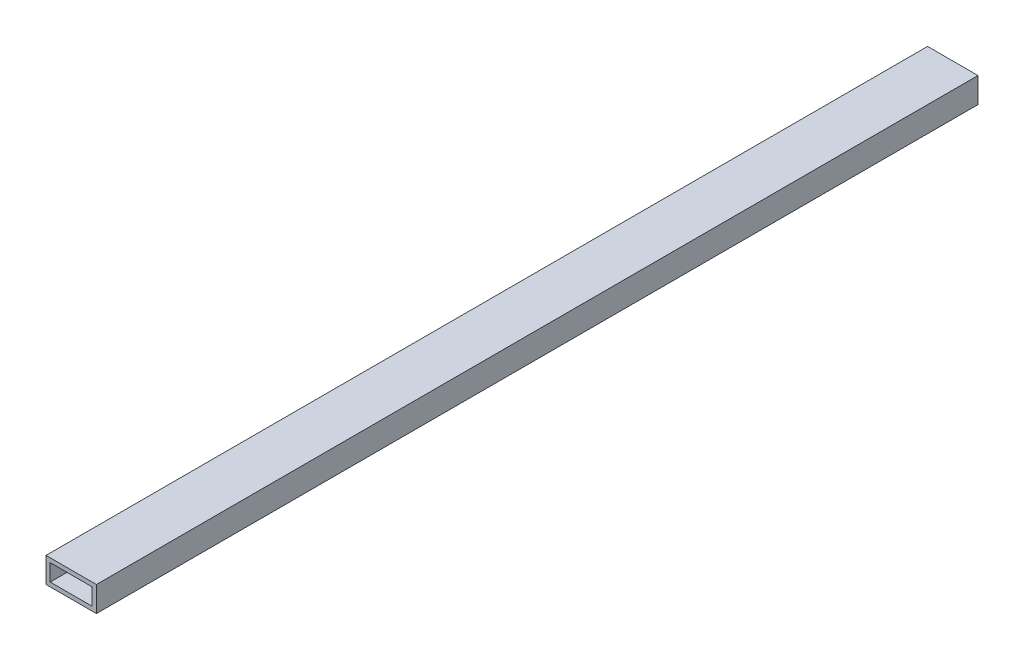
from build123d import *

# Parameters (mm, degrees)
SKETCH2_W           = 38.1
SKETCH2_H           = 19.05
BOSS_EXTRUDE1_DEPTH = 666.242
SKETCH4_W           = 31.75
SKETCH4_H           = 12.7
CUT_EXTRUDE1_DEPTH  = 668.053109232


with BuildPart() as part:
    # Sketch2 → Boss-Extrude1 (new body)
    with BuildSketch(Plane.XY):
        with Locations((-10.259093805, 5.388919414)):
            Rectangle(SKETCH2_W, SKETCH2_H)
    extrude(amount=BOSS_EXTRUDE1_DEPTH)

    # Sketch4 → Cut-Extrude1 (cut, through all)
    with BuildSketch(Plane(origin=(0, 0, 0), x_dir=(-1, 0, 0), z_dir=(0, 0, -1))):
        with Locations((10.259093805, 5.388919414)):
            Rectangle(SKETCH4_W, SKETCH4_H)
    extrude(amount=-CUT_EXTRUDE1_DEPTH, mode=Mode.SUBTRACT)


solid = part.part
